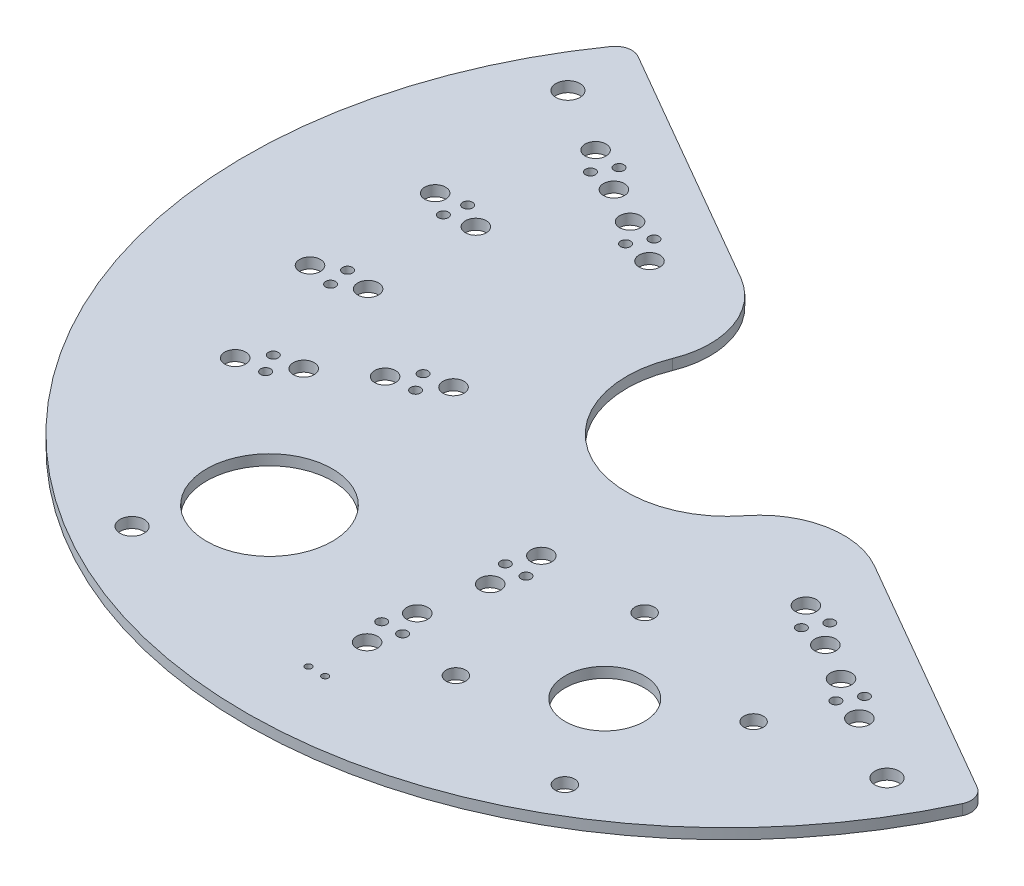
from build123d import *

# Parameters (mm, degrees)
SKETCH1_R           = 73.025
SKETCH1_R_2         = 15.24
SKETCH1_R_3         = 0.75
SKETCH1_R_4         = 1.585
SKETCH1_R_5         = 20
SKETCH1_R_6         = 9.525
SKETCH1_R_7         = 6
BOSS_EXTRUDE1_DEPTH = 1.5875
SKETCH2_R           = 1.8288
CUT_EXTRUDE1_DEPTH  = 104.285146107
CUT_EXTRUDE2_DEPTH  = 104.285146107
FILLET1_R           = 12.7
FILLET2_R           = 2.54
SKETCH4_R           = 0.4953
CUT_EXTRUDE3_DEPTH  = 104.285146107
SKETCH5_R           = 0.4953
SKETCH5_R_2         = 0.75
BOSS_EXTRUDE2_DEPTH = 0.1016
SKETCH6_R           = 1.4732
CUT_EXTRUDE4_DEPTH  = 104.285146107


with BuildPart() as part:
    # Sketch1 → Boss-Extrude1 (new body)
    with BuildSketch(Plane(origin=(0, 0, 0), x_dir=(1, 0, 0), z_dir=(0, 1, 0))):
        Circle(SKETCH1_R)
        Circle(SKETCH1_R_2, mode=Mode.SUBTRACT)
        with Locations((-1.585, 50.8)):
            Circle(SKETCH1_R_3, mode=Mode.SUBTRACT)
        with Locations((1.585, 50.8)):
            Circle(SKETCH1_R_3, mode=Mode.SUBTRACT)
        with Locations((0, 54.6)):
            Circle(SKETCH1_R_4, mode=Mode.SUBTRACT)
        with Locations((0, 47)):
            Circle(SKETCH1_R_4, mode=Mode.SUBTRACT)
        with Locations((47.284987047, 27.3)):
            Circle(SKETCH1_R_4, mode=Mode.SUBTRACT)
        with Locations((43.201590512, 26.772650265)):
            Circle(SKETCH1_R_3, mode=Mode.SUBTRACT)
        with Locations((44.786590512, 24.027349735)):
            Circle(SKETCH1_R_3, mode=Mode.SUBTRACT)
        with Locations((40.703193978, 23.5)):
            Circle(SKETCH1_R_4, mode=Mode.SUBTRACT)
        with Locations((47.284987047, -27.3)):
            Circle(SKETCH1_R_4, mode=Mode.SUBTRACT)
        with Locations((44.786590512, -24.027349735)):
            Circle(SKETCH1_R_3, mode=Mode.SUBTRACT)
        with Locations((43.201590512, -26.772650265)):
            Circle(SKETCH1_R_3, mode=Mode.SUBTRACT)
        with Locations((40.703193978, -23.5)):
            Circle(SKETCH1_R_4, mode=Mode.SUBTRACT)
        with Locations((0, -54.6)):
            Circle(SKETCH1_R_4, mode=Mode.SUBTRACT)
        with Locations((1.585, -50.8)):
            Circle(SKETCH1_R_3, mode=Mode.SUBTRACT)
        with Locations((-1.585, -50.8)):
            Circle(SKETCH1_R_3, mode=Mode.SUBTRACT)
        with Locations((0, -47)):
            Circle(SKETCH1_R_4, mode=Mode.SUBTRACT)
        with Locations((-47.284987047, -27.3)):
            Circle(SKETCH1_R_4, mode=Mode.SUBTRACT)
        with Locations((-43.201590512, -26.772650265)):
            Circle(SKETCH1_R_3, mode=Mode.SUBTRACT)
        with Locations((-44.786590512, -24.027349735)):
            Circle(SKETCH1_R_3, mode=Mode.SUBTRACT)
        with Locations((-40.703193978, -23.5)):
            Circle(SKETCH1_R_4, mode=Mode.SUBTRACT)
        with Locations((-47.284987047, 27.3)):
            Circle(SKETCH1_R_4, mode=Mode.SUBTRACT)
        with Locations((-44.786590512, 24.027349735)):
            Circle(SKETCH1_R_3, mode=Mode.SUBTRACT)
        with Locations((-43.201590512, 26.772650265)):
            Circle(SKETCH1_R_3, mode=Mode.SUBTRACT)
        with Locations((-40.703193978, 23.5)):
            Circle(SKETCH1_R_4, mode=Mode.SUBTRACT)
        with Locations((25.4, 43.994090512)):
            Circle(SKETCH1_R_5, mode=Mode.SUBTRACT)
        with Locations((-25.4, -43.994090512)):
            Circle(SKETCH1_R_6, mode=Mode.SUBTRACT)
        with Locations((25.4, -43.994090512)):
            Circle(SKETCH1_R_7, mode=Mode.SUBTRACT)
        with Locations((-46.285964392, 8.16146435)):
            Circle(SKETCH1_R_4, mode=Mode.SUBTRACT)
        with Locations((-50.303466215, 7.260407137)):
            Circle(SKETCH1_R_3, mode=Mode.SUBTRACT)
        with Locations((-49.753001491, 10.382247714)):
            Circle(SKETCH1_R_3, mode=Mode.SUBTRACT)
        with Locations((-53.770503314, 9.481190501)):
            Circle(SKETCH1_R_4, mode=Mode.SUBTRACT)
        with Locations((-46.285964392, -8.16146435)):
            Circle(SKETCH1_R_4, mode=Mode.SUBTRACT)
        with Locations((-49.753001491, -10.382247714)):
            Circle(SKETCH1_R_3, mode=Mode.SUBTRACT)
        with Locations((-50.303466215, -7.260407137)):
            Circle(SKETCH1_R_3, mode=Mode.SUBTRACT)
        with Locations((-53.770503314, -9.481190501)):
            Circle(SKETCH1_R_4, mode=Mode.SUBTRACT)
        with Locations((-29.397305699, -17.855276467)):
            Circle(SKETCH1_R_3, mode=Mode.SUBTRACT)
        with Locations((-31.002036221, -15.116847022)):
            Circle(SKETCH1_R_3, mode=Mode.SUBTRACT)
        with Locations((-33.503208801, -18.377965576)):
            Circle(SKETCH1_R_4, mode=Mode.SUBTRACT)
        with Locations((-26.914267425, -14.590346807)):
            Circle(SKETCH1_R_4, mode=Mode.SUBTRACT)
        with Locations((0.18310412, -33.841026905)):
            Circle(SKETCH1_R_3, mode=Mode.SUBTRACT)
        with Locations((3.356893615, -33.875899805)):
            Circle(SKETCH1_R_3, mode=Mode.SUBTRACT)
        with Locations((1.849768537, -30.052376234)):
            Circle(SKETCH1_R_4, mode=Mode.SUBTRACT)
        with Locations((1.702835812, -37.650969207)):
            Circle(SKETCH1_R_4, mode=Mode.SUBTRACT)
        with Locations((30.985856532, -19.788486735)):
            Circle(SKETCH1_R_3, mode=Mode.SUBTRACT)
        with Locations((32.50665139, -17.002568775)):
            Circle(SKETCH1_R_3, mode=Mode.SUBTRACT)
        with Locations((28.42312809, -16.538245649)):
            Circle(SKETCH1_R_4, mode=Mode.SUBTRACT)
        with Locations((35.063306729, -20.235302863)):
            Circle(SKETCH1_R_4, mode=Mode.SUBTRACT)
        with Locations((-32.704469206, 17.259289581)):
            Circle(SKETCH1_R_3, mode=Mode.SUBTRACT)
        with Locations((-31.183674349, 20.045207541)):
            Circle(SKETCH1_R_3, mode=Mode.SUBTRACT)
        with Locations((-35.267197648, 20.509530667)):
            Circle(SKETCH1_R_4, mode=Mode.SUBTRACT)
        with Locations((-28.627019009, 16.812473453)):
            Circle(SKETCH1_R_4, mode=Mode.SUBTRACT)
    extrude(amount=-BOSS_EXTRUDE1_DEPTH)

    # Sketch2 → Cut-Extrude1 (cut, through all)
    with BuildSketch(Plane(origin=(0, 0, 0), x_dir=(1, 0, 0), z_dir=(0, 1, 0))):
        with Locations((-57.192317666, 33.02)):
            Circle(SKETCH2_R)
        with Locations((33.02, 57.192317666)):
            Circle(SKETCH2_R)
        with Locations((57.192317666, -33.02)):
            Circle(SKETCH2_R)
        with Locations((-33.02, -57.192317666)):
            Circle(SKETCH2_R)
    extrude(amount=-CUT_EXTRUDE1_DEPTH, mode=Mode.SUBTRACT)

    # Sketch3 → Cut-Extrude2 (cut, through all)
    with BuildSketch(Plane(origin=(0, 0, 0), x_dir=(1, 0, 0), z_dir=(0, 1, 0))):
        with BuildLine():
            Line((-59.533825484, 44.637157955), (68.423825484, -29.239226276))
            ThreePointArc((68.423825484, -29.239226276), (37.204677955, 64.440392498), (-59.533825484, 44.637157955))
        make_face()
    extrude(amount=-CUT_EXTRUDE2_DEPTH, mode=Mode.SUBTRACT)

    # Fillet1
    fillet1_edges = [part.edges().sort_by_distance(p)[0] for p in [
        (15.165033815, -0.79375, -1.509751431),
        (-6.275033815, -0.79375, -13.888180249),
    ]]
    fillet(fillet1_edges, radius=FILLET1_R)

    # Fillet2
    fillet2_edges = [part.edges().sort_by_distance(p)[0] for p in [
        (67.216123088, -0.79375, 28.541958973),
        (-58.326123088, -0.79375, -43.939890652),
    ]]
    fillet(fillet2_edges, radius=FILLET2_R)

    # Sketch4 → Cut-Extrude3 (cut, through all)
    with BuildSketch(Plane(origin=(0, 0, 0), x_dir=(1, 0, 0), z_dir=(0, 1, 0))):
        with Locations((1.27, -62.23)):
            Circle(SKETCH4_R)
        with Locations((-1.27, -62.23)):
            Circle(SKETCH4_R)
    extrude(amount=-CUT_EXTRUDE3_DEPTH, mode=Mode.SUBTRACT)

    # Sketch5 → Boss-Extrude2 (add)
    # profile 1 of 10: a face of its own
    with BuildSketch(Plane.XZ.offset(1.5875)):
        with BuildLine():
            Line((34.490720839, 15.234132112), (45.023794735, 21.301797022))
            ThreePointArc((45.023794735, 21.301797022), (44.640302422, 22.09416322), (44.242866733, 22.879628318))
            ThreePointArc((44.242866733, 22.879628318), (44.194605568, 25.15093944), (46.040660753, 23.82683083))
            ThreePointArc((46.040660753, 23.82683083), (46.421042895, 23.076981746), (46.789213502, 22.321062023))
            Line((46.789213502, 22.321062023), (54.774266163, 26.931234326))
            ThreePointArc((54.774266163, 26.931234326), (32.789239067, 51.481816376), (1.245393112, 61.024262486))
            ThreePointArc((1.245393112, 61.024262486), (0.064262486, 62.254606888), (1.294606888, 63.435737514))
            ThreePointArc((1.294606888, 63.435737514), (34.873073505, 53.006014236), (57.7422016, 26.298421156))
            Line((57.7422016, 26.298421156), (28.012465947, 9.133950273))
            ThreePointArc((28.012465947, 9.133950273), (-12.042501731, 20.858224848), (-21.916465947, -19.692531996))
            Line((-21.916465947, -19.692531996), (-41.53590206, -31.019818717))
            ThreePointArc((-41.53590206, -31.019818717), (-42.622921376, -29.508420604), (-43.654971216, -27.958966385))
            ThreePointArc((-43.654971216, -27.958966385), (-43.878655247, -25.698181398), (-41.935772719, -26.875632368))
            ThreePointArc((-41.935772719, -26.875632368), (-41.454257835, -27.61255432), (-40.959794735, -28.340851504))
            Line((-40.959794735, -28.340851504), (-30.537815121, -22.27790388))
            Line((-30.537815121, -22.27790388), (-31.053590427, -21.385433264))
            ThreePointArc((-31.053590427, -21.385433264), (-31.761936541, -19.017766992), (-30.06523382, -20.814652539))
            Line((-30.06523382, -20.814652539), (-29.551271602, -21.703985881))
            Line((-29.551271602, -21.703985881), (-25.045535575, -19.082790815))
            ThreePointArc((-25.045535575, -19.082790815), (-13.264226318, 23.017060497), (29.071086472, 12.112106614))
            Line((29.071086472, 12.112106614), (33.500885608, 14.663929286))
            ThreePointArc((33.500885608, 14.663929286), (33.174864003, 15.236775822), (32.841290582, 15.805258023))
            ThreePointArc((32.841290582, 15.805258023), (31.60714545, 17.921497395), (33.747259191, 16.729232129))
            ThreePointArc((33.747259191, 16.729232129), (34.125009903, 15.984675603), (34.490720839, 15.234132112))
        make_face()
        with Locations((1.27, 62.23)):
            Circle(SKETCH5_R, mode=Mode.SUBTRACT)
        with Locations((44.786590512, 24.027349735)):
            Circle(SKETCH5_R_2, mode=Mode.SUBTRACT)
        with Locations((-43.201590512, -26.772650265)):
            Circle(SKETCH5_R_2, mode=Mode.SUBTRACT)
        with Locations((-31.173750375, -20.038911028)):
            Circle(SKETCH5_R_2, mode=Mode.SUBTRACT)
        with Locations((32.507430232, 16.993318336)):
            Circle(SKETCH5_R_2, mode=Mode.SUBTRACT)
    # profile 2 of 10: a face of its own
    with BuildSketch(Plane.XZ.offset(1.5875)):
        with BuildLine():
            Line((33.336492348, 26.169869047), (41.535902035, 31.019818701))
            ThreePointArc((41.535902035, 31.019818701), (42.622921339, 29.508420605), (43.654971168, 27.958966404))
            ThreePointArc((43.654971168, 27.958966404), (43.878655268, 25.698181412), (41.935772719, 26.875632368))
            ThreePointArc((41.935772719, 26.875632368), (41.454257835, 27.61255432), (40.959794735, 28.340851504))
            Line((40.959794735, 28.340851504), (32.479535914, 23.822017232))
            ThreePointArc((32.479535914, 23.822017232), (19.997147631, 34.964594161), (4.064, 40.073590583))
            Line((4.064, 40.073590583), (4.064, 49.642648525))
            ThreePointArc((4.064, 49.642648525), (3.186044586, 49.706717539), (2.307094012, 49.755260685))
            ThreePointArc((2.307094012, 49.755260685), (0.3159503, 50.849120845), (2.385689572, 51.785797245))
            ThreePointArc((2.385689572, 51.785797245), (4.243581194, 51.666742975), (6.095999999, 51.48105569))
            Line((6.095999999, 51.48105569), (6.095999999, 41.940702808))
            ThreePointArc((6.095999999, 41.940702808), (21.234645336, 36.677971665), (33.336492348, 26.169869047))
        make_face()
        with Locations((1.585, 50.8)):
            Circle(SKETCH5_R_2, mode=Mode.SUBTRACT)
        with Locations((43.201590512, 26.772650265)):
            Circle(SKETCH5_R_2, mode=Mode.SUBTRACT)
    # profile 3 of 10: a face of its own
    with BuildSketch(Plane.XZ.offset(1.5875)):
        with BuildLine():
            Line((-6.095999999, 38.638067239), (-6.095999999, 51.481055694))
            ThreePointArc((-6.095999999, 51.481055694), (-4.243581193, 51.666742978), (-2.38568957, 51.785797247))
            ThreePointArc((-2.38568957, 51.785797247), (-0.3159503, 50.849120844), (-2.307094012, 49.755260685))
            ThreePointArc((-2.307094012, 49.755260685), (-3.186044586, 49.706717539), (-4.064, 49.642648525))
            Line((-4.064, 49.642648525), (-4.064, 36.860642425))
            ThreePointArc((-4.064, 36.860642425), (-18.542, 32.115686074), (-29.89025274, 21.949848454))
            Line((-29.89025274, 21.949848454), (-40.959794734, 28.340851504))
            ThreePointArc((-40.959794734, 28.340851504), (-41.454257834, 27.612554318), (-41.935772719, 26.875632366))
            ThreePointArc((-41.935772719, 26.875632366), (-43.878655251, 25.698181402), (-43.654971208, 27.958966388))
            ThreePointArc((-43.654971208, 27.958966388), (-42.622921369, 29.508420604), (-41.535902055, 31.019818714))
            Line((-41.535902055, 31.019818714), (-30.413547783, 24.598324481))
            ThreePointArc((-30.413547783, 24.598324481), (-19.558, 33.875449694), (-6.095999999, 38.638067239))
        make_face()
        with Locations((-1.585, 50.8)):
            Circle(SKETCH5_R_2, mode=Mode.SUBTRACT)
        with Locations((-43.201590512, 26.772650265)):
            Circle(SKETCH5_R_2, mode=Mode.SUBTRACT)
    # profile 4 of 10: a face of its own
    with BuildSketch(Plane.XZ.offset(1.5875)):
        with BuildLine():
            ThreePointArc((-1.137328397, 61.026372169), (-0.059313178, 62.253645904), (-1.184427719, 63.437890349))
            ThreePointArc((-1.184427719, 63.437890349), (-54.638937722, 32.254538991), (-56.114446604, -29.613133627))
            ThreePointArc((-56.114446604, -29.613133627), (-54.535716158, -29.885091506), (-54.048929792, -28.358857598))
            ThreePointArc((-54.048929792, -28.358857598), (-52.52438099, 31.091815927), (-1.137328397, 61.026372169))
        make_face()
        with Locations((-1.27, 62.23)):
            Circle(SKETCH5_R, mode=Mode.SUBTRACT)
    # profile 5 of 10: a face of its own
    with BuildSketch(Plane.XZ.offset(1.5875)):
        with BuildLine():
            ThreePointArc((-48.598743805, -10.911954419), (-50.021744231, -9.141007471), (-50.584784003, -11.341954885))
            ThreePointArc((-50.584784003, -11.341954885), (-48.714342612, -17.730570692), (-46.040660761, -23.826830882))
            ThreePointArc((-46.040660761, -23.826830882), (-44.194605546, -25.150939428), (-44.242866733, -22.879628318))
            ThreePointArc((-44.242866733, -22.879628318), (-46.804887207, -17.035585761), (-48.598743805, -10.911954419))
        make_face()
        with Locations((-49.753001492, -10.382247714)):
            Circle(SKETCH5_R_2, mode=Mode.SUBTRACT)
        with Locations((-44.786590512, -24.027349735)):
            Circle(SKETCH5_R_2, mode=Mode.SUBTRACT)
    # profile 6 of 10: a face of its own
    with BuildSketch(Plane.XZ.offset(1.5875)):
        with BuildLine():
            ThreePointArc((-51.413325287, -6.643063764), (-50.131472618, -8.518706864), (-49.399989147, -6.367866276))
            ThreePointArc((-49.399989147, -6.367866276), (-49.808720609, 0), (-49.399989147, 6.367866277))
            ThreePointArc((-49.399989147, 6.367866277), (-50.131472619, 8.518706864), (-51.413325286, 6.643063762))
            ThreePointArc((-51.413325286, 6.643063762), (-51.840720608, -1e-09), (-51.413325287, -6.643063764))
        make_face()
        with Locations((-50.303466215, 7.260407137)):
            Circle(SKETCH5_R_2, mode=Mode.SUBTRACT)
        with Locations((-50.303466215, -7.260407137)):
            Circle(SKETCH5_R_2, mode=Mode.SUBTRACT)
    # profile 7 of 10: a face of its own
    with BuildSketch(Plane.XZ.offset(1.5875)):
        with BuildLine():
            ThreePointArc((-50.584784, 11.341954887), (-50.021744233, 9.141007472), (-48.598743805, 10.911954418))
            ThreePointArc((-48.598743805, 10.911954418), (-46.804887206, 17.035585761), (-44.242866731, 22.879628319))
            ThreePointArc((-44.242866731, 22.879628319), (-44.194605549, 25.15093943), (-46.04066076, 23.826830875))
            ThreePointArc((-46.04066076, 23.826830875), (-46.866502555, 22.158322389), (-47.631902057, 20.461236993))
            ThreePointArc((-47.631902057, 20.461236993), (-49.319566924, 15.96999159), (-50.584784, 11.341954887))
        make_face()
        with Locations((-44.786590512, 24.027349735)):
            Circle(SKETCH5_R_2, mode=Mode.SUBTRACT)
        with Locations((-49.753001492, 10.382247714)):
            Circle(SKETCH5_R_2, mode=Mode.SUBTRACT)
    # profile 8 of 10: a face of its own
    with BuildSketch(Plane.XZ.offset(1.5875)):
        with BuildLine():
            ThreePointArc((29.750286049, 20.294824353), (31.818786572, 18.884056056), (30.842384069, 21.189614503))
            ThreePointArc((30.842384069, 21.189614503), (19.436792184, 31.341447854), (4.523593019, 34.619211922))
            ThreePointArc((4.523593019, 34.619211922), (2.183689823, 33.970896872), (4.484099362, 33.193995769))
            ThreePointArc((4.484099362, 33.193995769), (18.709722164, 29.863769073), (29.750286049, 20.294824353))
        make_face()
        with Locations((3.354949812, 33.875033472)):
            Circle(SKETCH5_R_2, mode=Mode.SUBTRACT)
        with Locations((30.984541636, 19.78920211)):
            Circle(SKETCH5_R_2, mode=Mode.SUBTRACT)
    # profile 9 of 10: a face of its own
    with BuildSketch(Plane.XZ.offset(1.5875)):
        with BuildLine():
            ThreePointArc((-0.892844209, 32.974481926), (1.313564772, 33.515723797), (-0.44322017, 34.956171651))
            ThreePointArc((-0.44322017, 34.956171651), (-16.808276637, 30.222831543), (-29.697033, 19.082834184))
            ThreePointArc((-29.697033, 19.082834184), (-30.254991066, 16.880593019), (-28.158390528, 17.75549275))
            ThreePointArc((-28.158390528, 17.75549275), (-16.302373049, 28.548130039), (-0.892844209, 32.974481926))
        make_face()
        with Locations((-29.39844648, 17.849058536)):
            Circle(SKETCH5_R_2, mode=Mode.SUBTRACT)
        with Locations((0.184301483, 33.838710291)):
            Circle(SKETCH5_R_2, mode=Mode.SUBTRACT)
    # profile 10 of 10: a face of its own
    with BuildSketch(Plane.XZ.offset(1.5875)):
        with BuildLine():
            ThreePointArc((-31.336769265, 13.038282839), (-30.328093766, 16.217420137), (-32.984953468, 14.201127316))
            ThreePointArc((-32.984953468, 14.201127316), (-33.66330563, 12.920695881), (-34.330413979, 11.634370586))
            ThreePointArc((-34.330413979, 11.634370586), (-37.669342414, -2.643171748), (-33.915331162, -16.817234599))
            ThreePointArc((-33.915331162, -16.817234599), (-32.492330711, -18.588181541), (-31.929291004, -16.3872341))
            ThreePointArc((-31.929291004, -16.3872341), (-32.27952678, -15.643177599), (-32.64152132, -14.904770442))
            ThreePointArc((-32.64152132, -14.904770442), (-35.634138362, -0.763047218), (-31.336769265, 13.038282839))
        make_face()
        with Locations((-32.718295999, -17.260138496)):
            Circle(SKETCH5_R_2, mode=Mode.SUBTRACT)
        with Locations((-31.007036728, 15.122901043)):
            Circle(SKETCH5_R_2, mode=Mode.SUBTRACT)
    extrude(amount=BOSS_EXTRUDE2_DEPTH)

    # Sketch6 → Cut-Extrude4 (cut, through all)
    with BuildSketch(Plane.XZ.offset(1.5875)):
        with Locations((33.655, 58.292169929)):
            Circle(SKETCH6_R)
        with Locations((11.101920584, 52.249090512)):
            Circle(SKETCH6_R)
        with Locations((17.145, 29.696011096)):
            Circle(SKETCH6_R)
        with Locations((39.698079417, 35.739090512)):
            Circle(SKETCH6_R)
    extrude(amount=-CUT_EXTRUDE4_DEPTH, mode=Mode.SUBTRACT)


solid = part.part
